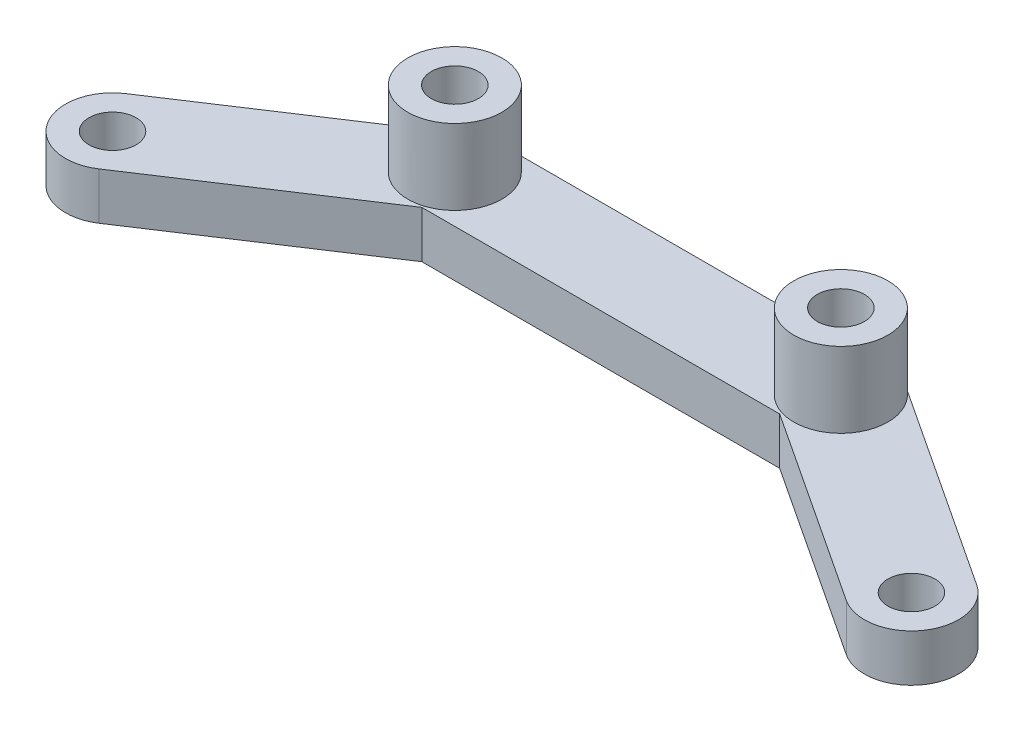
from build123d import *

# Parameters (mm, degrees)
SKETCH2_R           = 2.5
BOSS_EXTRUDE1_DEPTH = 5
SKETCH3_R           = 5
SKETCH3_R_2         = 2.5
BOSS_EXTRUDE2_DEPTH = 8
FILLET1_R           = 5


with BuildPart() as part:
    # Sketch2 → Boss-Extrude1 (new body)
    with BuildSketch(Plane(origin=(0, 0, 0), x_dir=(1, 0, 0), z_dir=(0, 1, 0))):
        with BuildLine():
            Line((-39.678172905, -46.603392635), (-19.002648889, -33))
            Line((-19.002648889, -33), (19.002648889, -33))
            Line((19.002648889, -33), (39.678172905, -46.603392635))
            ThreePointArc((39.678172905, -46.603392635), (46.603392635, -45.174640837), (45.174640837, -38.249421108))
            Line((45.174640837, -38.249421108), (21.997351111, -23))
            Line((21.997351111, -23), (-21.997351111, -23))
            Line((-21.997351111, -23), (-45.174640837, -38.249421108))
            ThreePointArc((-45.174640837, -38.249421108), (-46.603392635, -45.174640837), (-39.678172905, -46.603392635))
        make_face()
        with Locations(Location((-42.426406871, -42.426406871, 0), (0, 0, 270))):
            Circle(SKETCH2_R, mode=Mode.SUBTRACT)
        with Locations(Location((-20.5, -28, 0), (0, 0, 270))):
            Circle(SKETCH2_R, mode=Mode.SUBTRACT)
        with Locations(Location((20.5, -28, 0), (0, 0, 270))):
            Circle(SKETCH2_R, mode=Mode.SUBTRACT)
        with Locations(Location((42.426406871, -42.426406871, 0), (0, 0, 270))):
            Circle(SKETCH2_R, mode=Mode.SUBTRACT)
    extrude(amount=BOSS_EXTRUDE1_DEPTH)

    # Sketch3 → Boss-Extrude2 (add)
    # profile 1 of 2: a face of its own
    with BuildSketch(Plane(origin=(0, 5, 0), x_dir=(1, 0, 0), z_dir=(0, 1, 0))):
        with Locations(Location((-20.5, -28, 0), (0, 0, 90))):
            Circle(SKETCH3_R)
        with Locations(Location((-20.5, -28, 0), (0, 0, 270))):
            Circle(SKETCH3_R_2, mode=Mode.SUBTRACT)
    # profile 2 of 2: a face of its own
    with BuildSketch(Plane(origin=(0, 5, 0), x_dir=(1, 0, 0), z_dir=(0, 1, 0))):
        with Locations(Location((20.5, -28, 0), (0, 0, 90))):
            Circle(SKETCH3_R)
        with Locations(Location((20.5, -28, 0), (0, 0, 270))):
            Circle(SKETCH3_R_2, mode=Mode.SUBTRACT)
    extrude(amount=BOSS_EXTRUDE2_DEPTH)

    # Fillet1
    # the kernel refuses this fillet: 5 mm, written as the material it takes off along each edge
    with BuildSketch(Plane(origin=(21.997351111, -3.743377778, 23), x_dir=(0.8353971526785962, 0, 0.5496467932195132), z_dir=(0, 1, 0)), Plane(origin=(-21.997351111, -3.743377778, 23), x_dir=(1, 0, 0), z_dir=(0, 1, 0))) as fillet1_piece_1:
        with BuildLine():
            CenterArc((FILLET1_R * 0.299470222244, -FILLET1_R), FILLET1_R, 90, 33.342784883)
            Line((-FILLET1_R * 0.250176570975, -FILLET1_R * 0.164602847321), (0, 0))
            Line((0, 0), (FILLET1_R * 0.299470222244, 0))
        make_face()
    extrude(amount=12.486755556, mode=Mode.SUBTRACT)


solid = part.part
